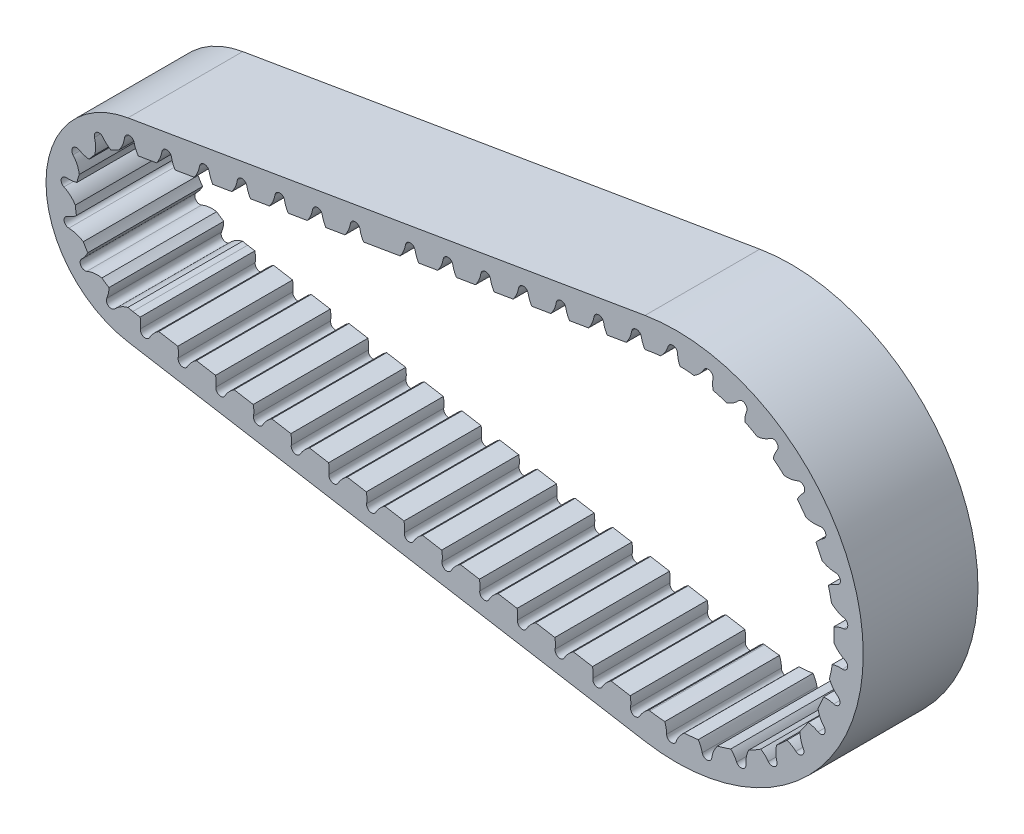
from build123d import *

# Parameters (mm, degrees)
EXTRUDE1_DEPTH     = 3
CUT_EXTRUDE1_DEPTH = 40.297101592
CRVPATTERN3_START  = -3
CRVPATTERN3_DEPTH  = 6


# Read off the part's stored shape, not the designer's step: CrvPattern3
with BuildPart() as part:
    # Sketch1 → Extrude1 (new, symmetric)
    with BuildSketch(Plane.XY):
        with BuildLine():
            Line((-0.857465345, 5.071522989), (26.175772245, 9.642154819))
            ThreePointArc((26.175772245, 9.642154819), (37.585015, 0), (26.175772245, -9.642154819))
            Line((26.175772245, -9.642154819), (-0.857465345, -5.071522989))
            ThreePointArc((-0.857465345, -5.071522989), (-5.1435, 0), (-0.857465345, 5.071522989))
        make_face()
        with BuildLine():
            Line((-0.603401539, 3.568849511), (26.429836051, 8.139481341))
            ThreePointArc((26.429836051, 8.139481341), (36.061015, 0), (26.429836051, -8.139481341))
            Line((26.429836051, -8.139481341), (-0.603401539, -3.568849511))
            ThreePointArc((-0.603401539, -3.568849511), (-3.6195, 0), (-0.603401539, 3.568849511))
        make_face(mode=Mode.SUBTRACT)
    extrude(amount=EXTRUDE1_DEPTH, both=True)

    # Sketch2 → Cut-Extrude1 (cut, through all)
    with BuildSketch(Plane.XY.offset(3)):
        with BuildLine():
            Line((13.224065754, 5.774723474), (14.61318642, 5.774723474))
            ThreePointArc((14.61318642, 5.774723474), (14.315339281, 6.140829128), (14.152598573, 6.583843495))
            ThreePointArc((14.152598573, 6.583843495), (13.900402207, 6.790710113), (13.65250237, 6.578713709))
            ThreePointArc((13.65250237, 6.578713709), (13.503886464, 6.14175987), (13.224065754, 5.774723474))
        make_face()
    extrude(amount=-CUT_EXTRUDE1_DEPTH, mode=Mode.SUBTRACT)

    # CrvPattern3 outline → CrvPattern3 (cut)
    with BuildSketch(Plane.XY.offset(CRVPATTERN3_START)):
        with BuildLine():
            ThreePointArc((10.770292774, 6.091405488), (10.667901495, 5.749482012), (10.484173532, 5.44347601))
            Line((10.484173532, 5.44347601), (11.4598923, 5.608445198))
            ThreePointArc((11.4598923, 5.608445198), (11.342655992, 5.843760464), (11.270388977, 6.096535274))
            ThreePointArc((11.270388977, 6.096535274), (11.018192611, 6.303401892), (10.770292774, 6.091405488))
        make_face()
        with BuildLine():
            ThreePointArc((8.799286062, 5.758158463), (8.696894783, 5.416234986), (8.513166819, 5.110228984))
            Line((8.513166819, 5.110228984), (9.488885588, 5.275198173))
            ThreePointArc((9.488885588, 5.275198173), (9.37164928, 5.510513438), (9.299382264, 5.763288248))
            ThreePointArc((9.299382264, 5.763288248), (9.047185899, 5.970154866), (8.799286062, 5.758158463))
        make_face()
        with BuildLine():
            ThreePointArc((6.828279349, 5.424911437), (6.72588807, 5.082987961), (6.542160107, 4.776981959))
            Line((6.542160107, 4.776981959), (7.517878875, 4.941951147))
            ThreePointArc((7.517878875, 4.941951147), (7.400642567, 5.177266413), (7.328375552, 5.430041223))
            ThreePointArc((7.328375552, 5.430041223), (7.076179186, 5.636907841), (6.828279349, 5.424911437))
        make_face()
        with BuildLine():
            ThreePointArc((4.857272637, 5.091664412), (4.754881358, 4.749740935), (4.571153395, 4.443734933))
            Line((4.571153395, 4.443734933), (5.546872163, 4.608704122))
            ThreePointArc((5.546872163, 4.608704122), (5.429635855, 4.844019387), (5.35736884, 5.096794197))
            ThreePointArc((5.35736884, 5.096794197), (5.105172475, 5.303660815), (4.857272637, 5.091664412))
        make_face()
        with BuildLine():
            ThreePointArc((2.886265924, 4.758417386), (2.783874645, 4.41649391), (2.600146682, 4.110487908))
            Line((2.600146682, 4.110487908), (3.575865451, 4.275457096))
            ThreePointArc((3.575865451, 4.275457096), (3.458629142, 4.510772362), (3.386362127, 4.763547172))
            ThreePointArc((3.386362127, 4.763547172), (3.134165761, 4.970413789), (2.886265924, 4.758417386))
        make_face()
        with BuildLine():
            ThreePointArc((0.915259212, 4.425170361), (0.812867933, 4.083246884), (0.62913997, 3.777240882))
            Line((0.62913997, 3.777240882), (1.604858738, 3.942210071))
            ThreePointArc((1.604858738, 3.942210071), (1.48762243, 4.177525336), (1.415355415, 4.430300146))
            ThreePointArc((1.415355415, 4.430300146), (1.16315905, 4.637166764), (0.915259212, 4.425170361))
        make_face()
        with BuildLine():
            ThreePointArc((-1.034159408, 4.085888605), (-1.141048584, 3.699587813), (-1.350758506, 3.358010082))
            ThreePointArc((-1.350758506, 3.358010082), (-0.982750572, 3.483530043), (-0.603401539, 3.568849511))
            Line((-0.603401539, 3.568849511), (-0.31958359, 3.616835896))
            ThreePointArc((-0.31958359, 3.616835896), (-0.450371604, 3.852873155), (-0.534582679, 4.109247075))
            ThreePointArc((-0.534582679, 4.109247075), (-0.794153161, 4.306781804), (-1.034159408, 4.085888605))
        make_face()
        with BuildLine():
            ThreePointArc((-2.60946079, 3.309786361), (-2.549647613, 2.913458238), (-2.601955505, 2.516069911))
            ThreePointArc((-2.601955505, 2.516069911), (-2.20233508, 2.872368438), (-1.754527554, 3.165819533))
            ThreePointArc((-1.754527554, 3.165819533), (-1.976520875, 3.330481117), (-2.16276747, 3.534703246))
            ThreePointArc((-2.16276747, 3.534703246), (-2.480305373, 3.609312124), (-2.60946079, 3.309786361))
        make_face()
        with BuildLine():
            ThreePointArc((-3.731747483, 1.95908961), (-3.515615803, 1.621538584), (-3.401440769, 1.237328148))
            ThreePointArc((-3.401440769, 1.237328148), (-3.181706026, 1.72555122), (-2.892355543, 2.176019224))
            ThreePointArc((-2.892355543, 2.176019224), (-3.162181707, 2.235921755), (-3.415485638, 2.346518277))
            ThreePointArc((-3.415485638, 2.346518277), (-3.735864885, 2.285248852), (-3.731747483, 1.95908961))
        make_face()
        with BuildLine():
            ThreePointArc((-4.206185228, 0.26828567), (-3.871256524, 0.048112192), (-3.610419887, -0.256219612))
            ThreePointArc((-3.610419887, -0.256219612), (-3.608717814, 0.279170179), (-3.528056981, 0.808451725))
            ThreePointArc((-3.528056981, 0.808451725), (-3.798872894, 0.753195839), (-4.075259404, 0.750966679))
            ThreePointArc((-4.075259404, 0.750966679), (-4.342860649, 0.564455611), (-4.206185228, 0.26828567))
        make_face()
        with BuildLine():
            ThreePointArc((-3.950409398, -1.469093925), (-3.55482887, -1.533666704), (-3.1926131, -1.70528644))
            ThreePointArc((-3.1926131, -1.70528644), (-3.409239185, -1.215676121), (-3.551271102, -0.699466803))
            ThreePointArc((-3.551271102, -0.699466803), (-3.776061847, -0.860288422), (-4.027548936, -0.974956274))
            ThreePointArc((-4.027548936, -0.974956274), (-4.195915341, -1.254329784), (-3.950409398, -1.469093925))
        make_face()
        with BuildLine():
            ThreePointArc((-3.008823882, -2.951431893), (-2.621266174, -2.849193833), (-2.220553635, -2.858307507))
            ThreePointArc((-2.220553635, -2.858307507), (-2.617900569, -2.499475318), (-2.957967827, -2.085954598))
            ThreePointArc((-2.957967827, -2.085954598), (-3.09770867, -2.32442256), (-3.280636994, -2.531622223))
            ThreePointArc((-3.280636994, -2.531622223), (-3.320539358, -2.855357618), (-3.008823882, -2.951431893))
        make_face()
        with BuildLine():
            ThreePointArc((-1.544892362, -3.921387377), (-1.232639319, -3.670087487), (-0.862995596, -3.515112922))
            ThreePointArc((-0.862995596, -3.515112922), (-1.372082078, -3.349353821), (-1.851147398, -3.110310846))
            ThreePointArc((-1.851147398, -3.110310846), (-1.881578671, -3.385025989), (-1.964191011, -3.648786626))
            ThreePointArc((-1.964191011, -3.648786626), (-1.868702096, -3.960681915), (-1.544892362, -3.921387377))
        make_face()
        with BuildLine():
            ThreePointArc((0.269447332, -4.315980023), (0.478555137, -4.026723107), (0.752670734, -3.798126788))
            Line((0.752670734, -3.798126788), (-0.223048034, -3.6331576))
            ThreePointArc((-0.223048034, -3.6331576), (-0.189688327, -3.893934815), (-0.204538212, -4.156417399))
            ThreePointArc((-0.204538212, -4.156417399), (-0.034367466, -4.434695536), (0.269447332, -4.315980023))
        make_face()
        with BuildLine():
            ThreePointArc((2.240454045, -4.649227049), (2.449561849, -4.359970132), (2.723677446, -4.131373813))
            Line((2.723677446, -4.131373813), (1.747958678, -3.966404625))
            ThreePointArc((1.747958678, -3.966404625), (1.781318385, -4.227181841), (1.766468501, -4.489664425))
            ThreePointArc((1.766468501, -4.489664425), (1.936639247, -4.767942562), (2.240454045, -4.649227049))
        make_face()
        with BuildLine():
            ThreePointArc((4.211460757, -4.982474074), (4.420568562, -4.693217158), (4.694684159, -4.464620839))
            Line((4.694684159, -4.464620839), (3.71896539, -4.299651651))
            ThreePointArc((3.71896539, -4.299651651), (3.752325097, -4.560428866), (3.737475213, -4.82291145))
            ThreePointArc((3.737475213, -4.82291145), (3.907645959, -5.101189587), (4.211460757, -4.982474074))
        make_face()
        with BuildLine():
            ThreePointArc((6.182467469, -5.3157211), (6.391575274, -5.026464183), (6.665690871, -4.797867864))
            Line((6.665690871, -4.797867864), (5.689972103, -4.632898676))
            ThreePointArc((5.689972103, -4.632898676), (5.72333181, -4.893675892), (5.708481925, -5.156158476))
            ThreePointArc((5.708481925, -5.156158476), (5.878652671, -5.434436613), (6.182467469, -5.3157211))
        make_face()
        with BuildLine():
            ThreePointArc((8.153474182, -5.648968125), (8.362581987, -5.359711209), (8.636697584, -5.13111489))
            Line((8.636697584, -5.13111489), (7.660978815, -4.966145702))
            ThreePointArc((7.660978815, -4.966145702), (7.694338522, -5.226922917), (7.679488638, -5.489405501))
            ThreePointArc((7.679488638, -5.489405501), (7.849659384, -5.767683638), (8.153474182, -5.648968125))
        make_face()
        with BuildLine():
            ThreePointArc((10.124480894, -5.982215151), (10.333588699, -5.692958234), (10.607704296, -5.464361915))
            Line((10.607704296, -5.464361915), (9.631985528, -5.299392727))
            ThreePointArc((9.631985528, -5.299392727), (9.665345235, -5.560169943), (9.65049535, -5.822652527))
            ThreePointArc((9.65049535, -5.822652527), (9.820666096, -6.100930664), (10.124480894, -5.982215151))
        make_face()
        with BuildLine():
            ThreePointArc((12.095487607, -6.315462176), (12.304595411, -6.026205259), (12.578711009, -5.797608941))
            Line((12.578711009, -5.797608941), (11.60299224, -5.632639753))
            ThreePointArc((11.60299224, -5.632639753), (11.636351947, -5.893416968), (11.621502063, -6.155899552))
            ThreePointArc((11.621502063, -6.155899552), (11.791672809, -6.434177689), (12.095487607, -6.315462176))
        make_face()
        with BuildLine():
            ThreePointArc((14.066494319, -6.648709202), (14.275602124, -6.359452285), (14.549717721, -6.130855966))
            Line((14.549717721, -6.130855966), (13.573998953, -5.965886778))
            ThreePointArc((13.573998953, -5.965886778), (13.60735866, -6.226663994), (13.592508775, -6.489146578))
            ThreePointArc((13.592508775, -6.489146578), (13.762679521, -6.767424715), (14.066494319, -6.648709202))
        make_face()
        with BuildLine():
            ThreePointArc((16.037501031, -6.981956227), (16.246608836, -6.692699311), (16.520724433, -6.464102992))
            Line((16.520724433, -6.464102992), (15.545005665, -6.299133804))
            ThreePointArc((15.545005665, -6.299133804), (15.578365372, -6.559911019), (15.563515488, -6.822393603))
            ThreePointArc((15.563515488, -6.822393603), (15.733686234, -7.10067174), (16.037501031, -6.981956227))
        make_face()
        with BuildLine():
            ThreePointArc((18.008507744, -7.315203253), (18.217615549, -7.025946336), (18.491731146, -6.797350017))
            Line((18.491731146, -6.797350017), (17.516012377, -6.632380829))
            ThreePointArc((17.516012377, -6.632380829), (17.549372084, -6.893158045), (17.5345222, -7.155640629))
            ThreePointArc((17.5345222, -7.155640629), (17.704692946, -7.433918766), (18.008507744, -7.315203253))
        make_face()
        with BuildLine():
            ThreePointArc((19.979514456, -7.648450278), (20.188622261, -7.359193362), (20.462737858, -7.130597043))
            Line((20.462737858, -7.130597043), (19.48701909, -6.965627855))
            ThreePointArc((19.48701909, -6.965627855), (19.520378797, -7.22640507), (19.505528912, -7.488887654))
            ThreePointArc((19.505528912, -7.488887654), (19.675699658, -7.767165791), (19.979514456, -7.648450278))
        make_face()
        with BuildLine():
            ThreePointArc((21.950521169, -7.981697304), (22.159628973, -7.692440387), (22.433744571, -7.463844068))
            Line((22.433744571, -7.463844068), (21.458025802, -7.29887488))
            ThreePointArc((21.458025802, -7.29887488), (21.491385509, -7.559652096), (21.476535625, -7.82213468))
            ThreePointArc((21.476535625, -7.82213468), (21.646706371, -8.100412817), (21.950521169, -7.981697304))
        make_face()
        with BuildLine():
            ThreePointArc((23.921527881, -8.314944329), (24.130635686, -8.025687413), (24.404751283, -7.797091094))
            Line((24.404751283, -7.797091094), (23.429032515, -7.632121906))
            ThreePointArc((23.429032515, -7.632121906), (23.462392222, -7.892899121), (23.447542337, -8.155381705))
            ThreePointArc((23.447542337, -8.155381705), (23.617713083, -8.433659842), (23.921527881, -8.314944329))
        make_face()
        with BuildLine():
            ThreePointArc((25.892534594, -8.648191355), (26.101642398, -8.358934438), (26.375757995, -8.130338119))
            Line((26.375757995, -8.130338119), (25.400039227, -7.965368931))
            ThreePointArc((25.400039227, -7.965368931), (25.433398934, -8.226146147), (25.41854905, -8.488628731))
            ThreePointArc((25.41854905, -8.488628731), (25.588719796, -8.766906868), (25.892534594, -8.648191355))
        make_face()
        with BuildLine():
            ThreePointArc((27.797964129, -8.848097678), (27.97230047, -8.518094148), (28.225951338, -8.244311886))
            ThreePointArc((28.225951338, -8.244311886), (27.716524206, -8.25451491), (27.207438018, -8.233269739))
            ThreePointArc((27.207438018, -8.233269739), (27.28138934, -8.491511692), (27.305838697, -8.759018577))
            ThreePointArc((27.305838697, -8.759018577), (27.514596649, -9.009651619), (27.797964129, -8.848097678))
        make_face()
        with BuildLine():
            ThreePointArc((29.666000768, -8.650395961), (29.766743697, -8.29102658), (29.956882163, -7.969867969))
            ThreePointArc((29.956882163, -7.969867969), (29.461089397, -8.087382379), (28.958991099, -8.174085338))
            ThreePointArc((28.958991099, -8.174085338), (29.085791361, -8.410896229), (29.166161088, -8.667213242))
            ThreePointArc((29.166161088, -8.667213242), (29.42312371, -8.868128685), (29.666000768, -8.650395961))
        make_face()
        with BuildLine():
            ThreePointArc((31.450203899, -8.062802528), (31.472812718, -7.690264837), (31.590868839, -7.336205178))
            ThreePointArc((31.590868839, -7.336205178), (31.13105687, -7.55573435), (30.658577098, -7.746477553))
            ThreePointArc((30.658577098, -7.746477553), (30.832511144, -7.951183811), (30.965178806, -8.184758201))
            ThreePointArc((30.965178806, -8.184758201), (31.258764247, -8.326900359), (31.450203899, -8.062802528))
        make_face()
        with BuildLine():
            ThreePointArc((33.070155698, -7.111801464), (33.013611379, -6.742886528), (33.054264114, -6.371884041))
            ThreePointArc((33.054264114, -6.371884041), (32.651157645, -6.683533329), (32.229592066, -6.969719574))
            ThreePointArc((32.229592066, -6.969719574), (32.442820319, -7.133094654), (32.621806303, -7.333398727))
            ThreePointArc((32.621806303, -7.333398727), (32.938782044, -7.410360951), (33.070155698, -7.111801464))
        make_face()
        with BuildLine():
            ThreePointArc((34.452841497, -5.840256404), (34.319692613, -5.491592003), (34.281109657, -5.120368559))
            ThreePointArc((34.281109657, -5.120368559), (33.952877552, -5.510091267), (33.601227022, -5.878821533))
            ThreePointArc((33.601227022, -5.878821533), (33.844138831, -5.993501773), (34.061375859, -6.151507399))
            ThreePointArc((34.061375859, -6.151507399), (34.387455131, -6.159820838), (34.452841497, -5.840256404))
        make_face()
        with BuildLine():
            ThreePointArc((35.53594071, -4.305478587), (35.332188564, -3.992779765), (35.216108933, -3.638067193))
            ThreePointArc((35.216108933, -3.638067193), (34.97754531, -4.088297691), (34.711659466, -4.522952522))
            ThreePointArc((34.711659466, -4.522952522), (34.97330628, -4.58376904), (35.219003018, -4.69235457))
            ThreePointArc((35.219003018, -4.69235457), (35.539488734, -4.63164452), (35.53594071, -4.305478587))
        make_face()
        with BuildLine():
            ThreePointArc((36.270635757, -2.576643706), (36.005463891, -2.314004464), (35.81711954, -1.991790412))
            ThreePointArc((35.81711954, -1.991790412), (35.678976968, -2.482235856), (35.510839849, -2.963224435))
            ThreePointArc((35.510839849, -2.963224435), (35.779428691, -2.967436102), (36.042511065, -3.021707355))
            ThreePointArc((36.042511065, -3.021707355), (36.342958254, -2.894710147), (36.270635757, -2.576643706))
        make_face()
        with BuildLine():
            ThreePointArc((36.623812371, -0.731674022), (36.309172644, -0.530932068), (36.057052653, -0.255739408))
            ThreePointArc((36.057052653, -0.255739408), (36.025557512, -0.764294381), (35.962747414, -1.269937531))
            ThreePointArc((35.962747414, -1.269937531), (36.226172415, -1.217354517), (36.494782743, -1.214865374))
            ThreePointArc((36.494782743, -1.214865374), (36.761649612, -1.027305041), (36.623812371, -0.731674022))
        make_face()
        with BuildLine():
            ThreePointArc((36.579552132, 1.146273763), (36.229626025, 1.276070563), (35.925093978, 1.491838314))
            ThreePointArc((35.925093978, 1.491838314), (36.001665819, 0.988095466), (36.047013727, 0.480588155))
            ThreePointArc((36.047013727, 0.480588155), (36.293401762, 0.587595821), (36.555433207, 0.64673317))
            ThreePointArc((36.555433207, 0.64673317), (36.776691501, 0.886402884), (36.579552132, 1.146273763))
        make_face()
        with BuildLine():
            ThreePointArc((36.139849943, 2.972556557), (35.770409368, 3.025557985), (35.427191171, 3.172175716))
            ThreePointArc((35.427191171, 3.172175716), (35.60837874, 2.695949752), (35.759840728, 2.209452712))
            ThreePointArc((35.759840728, 2.209452712), (35.978086566, 2.366061967), (36.221728814, 2.479182077))
            ThreePointArc((36.221728814, 2.479182077), (36.387405949, 2.760158751), (36.139849943, 2.972556557))
        make_face()
        with BuildLine():
            ThreePointArc((35.324524116, 4.664859913), (34.952220545, 4.638677083), (34.58578577, 4.709536421))
            ThreePointArc((34.58578577, 4.709536421), (34.863422559, 4.282291857), (35.114171913, 3.838732543))
            ThreePointArc((35.114171913, 3.838732543), (35.294438749, 4.037884676), (35.508710327, 4.199888982))
            ThreePointArc((35.508710327, 4.199888982), (35.611338885, 4.509508399), (35.324524116, 4.664859913))
        make_face()
        with BuildLine():
            ThreePointArc((34.170323117, 6.146908128), (33.811937062, 6.042721155), (33.438801704, 6.034628319))
            ThreePointArc((33.438801704, 6.034628319), (33.800374032, 5.675621975), (34.139108946, 5.294992547))
            ThreePointArc((34.139108946, 5.294992547), (34.273271772, 5.527711348), (34.448515004, 5.731297973))
            ThreePointArc((34.448515004, 5.731297973), (34.483469298, 6.055604929), (34.170323117, 6.146908128))
        make_face()
        with BuildLine():
            ThreePointArc((32.729269237, 7.351902139), (32.400953918, 7.174406952), (32.037935979, 7.087726704))
            ThreePointArc((32.037935979, 7.087726704), (32.467147014, 6.813139757), (32.878599987, 6.512595992))
            ThreePointArc((32.878599987, 6.512595992), (32.960611799, 6.768392331), (33.088928101, 7.004385193))
            ThreePointArc((33.088928101, 7.004385193), (33.054632665, 7.328762485), (32.729269237, 7.351902139))
        make_face()
        with BuildLine():
            ThreePointArc((31.066313832, 8.225530309), (30.782867119, 7.982726992), (30.446328588, 7.821366195))
            ThreePointArc((30.446328588, 7.821366195), (30.923832877, 7.643574863), (31.38945885, 7.436662906))
            ThreePointArc((31.38945885, 7.436662906), (31.415623202, 7.704007498), (31.491229085, 7.961769898))
            ThreePointArc((31.491229085, 7.961769898), (31.389229688, 8.271597152), (31.066313832, 8.225530309))
        make_face()
        with BuildLine():
            ThreePointArc((29.256409836, 8.72841636), (29.030607274, 8.431248575), (28.735716658, 8.202480102))
            ThreePointArc((28.735716658, 8.202480102), (29.239992069, 8.129497818), (29.738804289, 8.02554363))
            ThreePointArc((29.738804289, 8.02554363), (29.707941898, 8.292386688), (29.727429645, 8.560300726))
            ThreePointArc((29.727429645, 8.560300726), (29.562323617, 8.84161337), (29.256409836, 8.72841636))
        make_face()
        with BuildLine():
            ThreePointArc((27.381133465, 8.837894151), (27.223152454, 8.49975588), (26.983201099, 8.213890813))
            ThreePointArc((26.983201099, 8.213890813), (27.491518868, 8.249007042), (28.00103481, 8.252696061))
            ThreePointArc((28.00103481, 8.252696061), (27.914536709, 8.507010399), (27.877027967, 8.773000622))
            ThreePointArc((27.877027967, 8.773000622), (27.656256987, 9.013119299), (27.381133465, 8.837894151))
        make_face()
        with BuildLine():
            ThreePointArc((25.478542644, 8.578195862), (25.376151365, 8.236272386), (25.192423402, 7.930266384))
            Line((25.192423402, 7.930266384), (26.168142171, 8.095235572))
            ThreePointArc((26.168142171, 8.095235572), (26.050905863, 8.330550838), (25.978638847, 8.583325648))
            ThreePointArc((25.978638847, 8.583325648), (25.726442481, 8.790192266), (25.478542644, 8.578195862))
        make_face()
        with BuildLine():
            ThreePointArc((23.507535932, 8.244948837), (23.405144653, 7.903025361), (23.22141669, 7.597019359))
            Line((23.22141669, 7.597019359), (24.197135458, 7.761988547))
            ThreePointArc((24.197135458, 7.761988547), (24.07989915, 7.997303812), (24.007632135, 8.250078622))
            ThreePointArc((24.007632135, 8.250078622), (23.75543577, 8.45694524), (23.507535932, 8.244948837))
        make_face()
        with BuildLine():
            ThreePointArc((21.53652922, 7.911701811), (21.434137941, 7.569778335), (21.250409977, 7.263772333))
            Line((21.250409977, 7.263772333), (22.226128746, 7.428741521))
            ThreePointArc((22.226128746, 7.428741521), (22.108892438, 7.664056787), (22.036625423, 7.916831597))
            ThreePointArc((22.036625423, 7.916831597), (21.784429057, 8.123698215), (21.53652922, 7.911701811))
        make_face()
        with BuildLine():
            ThreePointArc((19.565522507, 7.578454786), (19.463131228, 7.236531309), (19.279403265, 6.930525307))
            Line((19.279403265, 6.930525307), (20.255122033, 7.095494496))
            ThreePointArc((20.255122033, 7.095494496), (20.137885725, 7.330809761), (20.06561871, 7.583584571))
            ThreePointArc((20.06561871, 7.583584571), (19.813422345, 7.790451189), (19.565522507, 7.578454786))
        make_face()
        with BuildLine():
            ThreePointArc((17.594515795, 7.24520776), (17.492124516, 6.903284284), (17.308396553, 6.597278282))
            Line((17.308396553, 6.597278282), (18.284115321, 6.76224747))
            ThreePointArc((18.284115321, 6.76224747), (18.166879013, 6.997562736), (18.094611998, 7.250337546))
            ThreePointArc((18.094611998, 7.250337546), (17.842415632, 7.457204164), (17.594515795, 7.24520776))
        make_face()
        with BuildLine():
            ThreePointArc((16.313108609, 6.429000445), (16.195872301, 6.66431571), (16.123605285, 6.91709052))
            ThreePointArc((16.123605285, 6.91709052), (15.87140892, 7.123957138), (15.623509082, 6.911960735))
            ThreePointArc((15.623509082, 6.911960735), (15.521117803, 6.570037258), (15.33738984, 6.264031256))
            Line((15.33738984, 6.264031256), (16.313108609, 6.429000445))
        make_face()
    extrude(amount=CRVPATTERN3_DEPTH, mode=Mode.SUBTRACT)


solid = part.part
